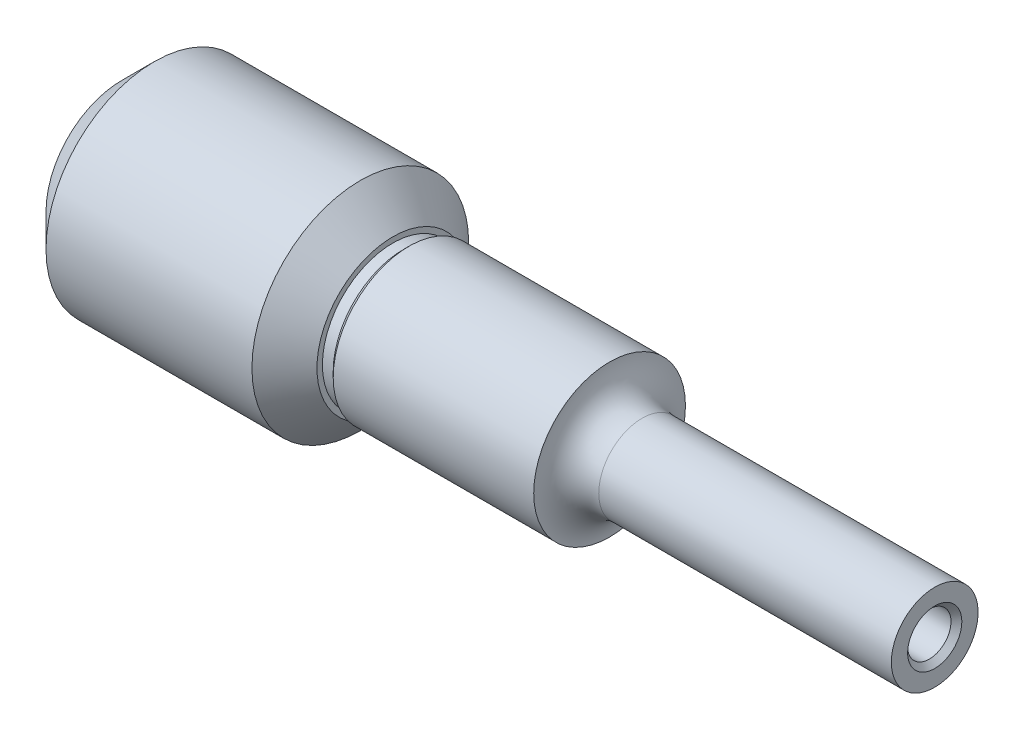
from build123d import *

# Parameters (mm, degrees)
CHAMFER2_SIZE = 6
CHAMFER3_SIZE = 3
CHAMFER4_SIZE = 1
FILLET1_R     = 6
CHAMFER5_SIZE = 1


with BuildPart() as part:
    # Sketch1 → Revolve2 (revolve)
    with BuildSketch(Plane.XY, mode=Mode.PRIVATE) as revolve2_sk:
        Polygon((0, -10), (0, -20), (50, -20), (50, -13), (52, -13), (52, -14), (90, -14), (90, -8), (150, -8), (150, -4), (125, -4), (125, 0), (36, 0), (36, -10), align=None)
    revolve(revolve2_sk.sketch.rotate(Axis((0, 0, 0), (1, 0, 0)), 270), axis=Axis((0, 0, 0), (1, 0, 0)))

    # Chamfer2
    chamfer2_edges = [part.edges().sort_by_distance(p)[0] for p in [
        (0, 0, -20),
        (50, 0, -20),
    ]]
    chamfer(chamfer2_edges, length=CHAMFER2_SIZE)

    # Chamfer3
    chamfer3_edges = [part.edges().sort_by_distance(p)[0] for p in [
        (0, 0, -10),
    ]]
    chamfer(chamfer3_edges, length=CHAMFER3_SIZE)

    # Chamfer4
    chamfer4_edges = [part.edges().sort_by_distance(p)[0] for p in [
        (150, 0, -4),
    ]]
    chamfer(chamfer4_edges, length=CHAMFER4_SIZE)

    # Fillet1
    fillet1_edges = [part.edges().sort_by_distance(p)[0] for p in [
        (90, 0, -8),
    ]]
    fillet(fillet1_edges, radius=FILLET1_R - 0.0001)  # a hair under: the kernel refuses the full size

    # Chamfer5
    chamfer5_edges = [part.edges().sort_by_distance(p)[0] for p in [
        (52, 0, -14),
    ]]
    chamfer(chamfer5_edges, length=CHAMFER5_SIZE - 0.0001)  # a hair under: the kernel refuses the full size


solid = part.part
